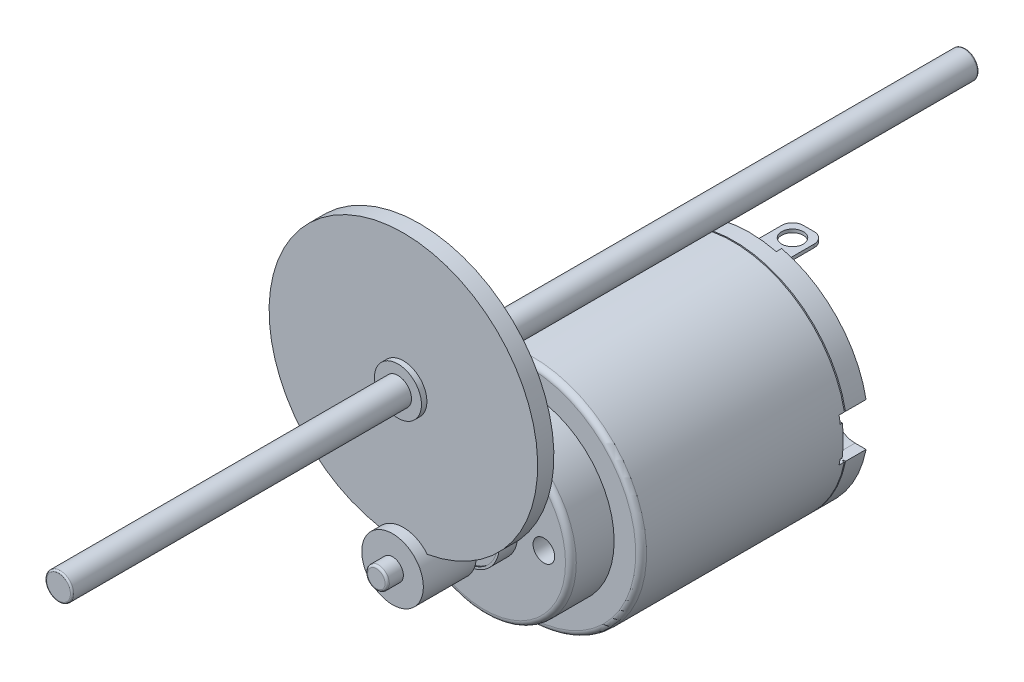
from build123d import *
from build123d.topology import SkipClean

# Parameters (mm, degrees)
ESBO_O1_R                   = 1
RESSALTO_EXTRUS_O1_DEPTH    = 38
ESBO_O2_R                   = 8
RESSALTO_EXTRUS_O2_DEPTH    = 25
ESBO_O3_R                   = 3.075
RESSALTO_EXTRUS_O3_DEPTH    = 1.7
ESBO_O4_R                   = 10.5
RESSALTO_EXTRUS_O4_DEPTH    = 21
ESBO_O5_R                   = 3.125
RESSALTO_EXTRUS_O5_DEPTH    = 2
ESBO_O6_W                   = 3
ESBO_O6_H                   = 0.3
RESSALTO_EXTRUS_O6_DEPTH    = 5
ESBO_O7_R                   = 1
CORTE_EXTRUS_O1_DEPTH       = 4
ESBO_O8_R                   = 1
CORTE_EXTRUS_O2_DEPTH       = 4
FILETE1_R                   = 1
FILETE2_R                   = 0.2
CORTE_EXTRUS_O3_DEPTH       = 15
CORTE_EXTRUS_O3_DEPTH_BACK  = 38
ESBO_O9_R                   = 1
ESBO_O10_W                  = 1.239132447
ESBO_O10_H                  = 9.327126009
CORTE_EXTRUS_O4_DEPTH       = 2
CORTE_EXTRUS_O5_DEPTH       = 0.5
CORTE_EXTRUS_O6_DEPTH       = 2
ESBO_O13_W                  = 3
ESBO_O13_H                  = 0.3
RESSALTO_EXTRUS_O7_DEPTH    = 6
ESBO_O14_R                  = 11.30933102
ESBO_O14_R_2                = 10.3
CORTE_EXTRUS_O7_DEPTH       = 0.1
FILETE3_R                   = 0.5
ESBO_O15_R                  = 2.875
CORTE_EXTRUS_O8_DEPTH       = 0.1
CORTE_EXTRUS_O9_DEPTH       = 2.5
RESSALTO_EXTRUS_O8_DEPTH    = 0.2
ESBO_O18_R                  = 2.85
RESSALTO_EXTRUS_O9_DEPTH    = 4.9
ESBO_O19_R                  = 12.425
RESSALTO_EXTRUS_O10_DEPTH   = 1.5
ESBO_O20_R                  = 2.175
RESSALTO_EXTRUS_O11_DEPTH   = 2
ESBO_O21_R                  = 2.175
RESSALTO_EXTRUS_O12_DEPTH   = 3.9
CORTE_EXTRUS_O10_DEPTH      = 12
CORTE_EXTRUS_O10_DEPTH_BACK = 7.9
ESBO_O22_R                  = 1.25
ESBO_O23_R                  = 1.25
RESSALTO_EXTRUS_O13_DEPTH   = 83.9
FILETE4_R                   = 0.15


with BuildPart() as part:
    # Esboço1 → Ressalto-extrusão1 (new body)
    with BuildSketch(Plane.XY):
        Circle(ESBO_O1_R)
    extrude(amount=RESSALTO_EXTRUS_O1_DEPTH)

    # Esboço2 → Ressalto-extrusão2 (add)
    with BuildSketch(Plane.XY.offset(28)):
        Circle(ESBO_O2_R)
    extrude(amount=-RESSALTO_EXTRUS_O2_DEPTH)

    # Esboço3 → Ressalto-extrusão3 (add)
    with BuildSketch(Plane.XY.offset(28)):
        Circle(ESBO_O3_R)
    extrude(amount=RESSALTO_EXTRUS_O3_DEPTH)

    # Esboço4 → Ressalto-extrusão4 (add)
    with BuildSketch(Plane(origin=(0, 0, 3), x_dir=(-1, 0, 0), z_dir=(0, 0, -1))):
        Circle(ESBO_O4_R)
    extrude(amount=-RESSALTO_EXTRUS_O4_DEPTH)

    # Esboço5 → Ressalto-extrusão5 (add)
    with BuildSketch(Plane(origin=(0, 0, 3), x_dir=(-1, 0, 0), z_dir=(0, 0, -1))):
        Circle(ESBO_O5_R)
    extrude(amount=RESSALTO_EXTRUS_O5_DEPTH)

    # Esboço6 → Ressalto-extrusão6 (add)
    with BuildSketch(Plane(origin=(0, 0, 3), x_dir=(-1, 0, 0), z_dir=(0, 0, -1))):
        with Locations((0, 7.9)):
            Rectangle(ESBO_O6_W, ESBO_O6_H)
        with Locations((0, -7.9)):
            Rectangle(ESBO_O6_W, ESBO_O6_H)
    extrude(amount=RESSALTO_EXTRUS_O6_DEPTH)

    # Esboço7 → Corte-extrusão1 (cut)
    with BuildSketch(Plane(origin=(0, 8.05, 0), x_dir=(1, 0, 0), z_dir=(0, 1, 0))):
        with Locations((0, 0.5)):
            Circle(ESBO_O7_R)
    extrude(amount=-CORTE_EXTRUS_O1_DEPTH, mode=Mode.SUBTRACT)

    # Esboço8 → Corte-extrusão2 (cut)
    with BuildSketch(Plane(origin=(0, -7.75, 0), x_dir=(1, 0, 0), z_dir=(0, 1, 0))):
        with Locations((0, 0.5)):
            Circle(ESBO_O8_R)
    extrude(amount=-CORTE_EXTRUS_O2_DEPTH, mode=Mode.SUBTRACT)

    # Filete1
    filete1_edges = [part.edges().sort_by_distance(p)[0] for p in [
        (1.5, -7.9, -2),
        (-1.5, -7.9, -2),
        (1.5, 7.9, -2),
        (-1.5, 7.9, -2),
    ]]
    fillet(filete1_edges, radius=FILETE1_R)

    # Filete2
    filete2_edges = [part.edges().sort_by_distance(p)[0] for p in [
        (-1, 0, 0),
        (-1, 0, 38),
    ]]
    fillet(filete2_edges, radius=FILETE2_R)

    # Esboço9 → Corte-extrusão3 (cut, two sides: drawn at the far end of the back side and taken through both)
    with BuildSketch(Plane(origin=(0, 0, 3), x_dir=(-1, 0, 0), z_dir=(0, 0, -1)).offset(-CORTE_EXTRUS_O3_DEPTH_BACK)):
        with Locations((-5.5, 0)):
            Circle(ESBO_O9_R)
        with Locations((5.5, 0)):
            Circle(ESBO_O9_R)
    extrude(amount=CORTE_EXTRUS_O3_DEPTH + CORTE_EXTRUS_O3_DEPTH_BACK, mode=Mode.SUBTRACT)

    # Esboço10 → Corte-extrusão4 (cut)
    with BuildSketch(Plane(origin=(0, 0, 1), x_dir=(-1, 0, 0), z_dir=(0, 0, -1))):
        with Locations((3.194566224, -0.245450684)):
            Rectangle(ESBO_O10_W, ESBO_O10_H)
    extrude(amount=-CORTE_EXTRUS_O4_DEPTH, mode=Mode.SUBTRACT)

    # Esboço11 → Corte-extrusão5 (cut)
    with BuildSketch(Plane(origin=(0, 0, 3), x_dir=(-1, 0, 0), z_dir=(0, 0, -1))):
        with BuildLine():
            Line((-3.708099244, 1.5), (-7.348469228, 1.5))
            ThreePointArc((-7.348469228, 1.5), (-5.657498182, 4.923689097), (-2.5, 7.071067812))
            Line((-2.5, 7.071067812), (-2.5, 12.5))
            Line((-2.5, 12.5), (2.5, 12.5))
            Line((2.5, 12.5), (2.5, 7.071067812))
            ThreePointArc((2.5, 7.071067812), (5.657498182, 4.923689097), (7.348469228, 1.5))
            Line((7.348469228, 1.5), (3.708099244, 1.5))
            ThreePointArc((3.708099244, 1.5), (3.208309493, 2.388880532), (2.5, 3.122498999))
            ThreePointArc((2.5, 3.122498999), (-1.011435463, 3.870012701), (-3.708099244, 1.5))
        make_face()
        with BuildLine():
            Line((7.348469228, -1.5), (3.708099244, -1.5))
            ThreePointArc((3.708099244, -1.5), (1.011435463, -3.870012701), (-2.5, -3.122498999))
            ThreePointArc((-2.5, -3.122498999), (-3.208309493, -2.388880532), (-3.708099244, -1.5))
            Line((-3.708099244, -1.5), (-7.348469228, -1.5))
            ThreePointArc((-7.348469228, -1.5), (-5.657498182, -4.923689097), (-2.5, -7.071067812))
            Line((-2.5, -7.071067812), (-2.5, -12.5))
            Line((-2.5, -12.5), (2.5, -12.5))
            Line((2.5, -12.5), (2.5, -7.071067812))
            ThreePointArc((2.5, -7.071067812), (5.657498182, -4.923689097), (7.348469228, -1.5))
        make_face()
    extrude(amount=-CORTE_EXTRUS_O5_DEPTH, mode=Mode.SUBTRACT)


with BuildPart() as corte_extrus_o5_piece_1:
    # of the separate pieces the step leaves, piece 1, a body of its own (corte_extrus_o5_pieces)
    add(part.part.solids().sort_by_distance((1, 0, 0.2))[0])

    # Esboço12 → Corte-extrusão6 (cut)
    with BuildSketch(Plane(origin=(0, 0, 3.5), x_dir=(-1, 0, 0), z_dir=(0, 0, -1))):
        with BuildLine():
            ThreePointArc((3.375, -5.845671476), (4.772970773, -4.772970773), (5.845671476, -3.375))
            ThreePointArc((5.845671476, -3.375), (5.479646072, -2.008974596), (4.113620668, -2.375))
            ThreePointArc((4.113620668, -2.375), (3.358757211, -3.358757211), (2.375, -4.113620668))
            ThreePointArc((2.375, -4.113620668), (2.008974596, -5.479646072), (3.375, -5.845671476))
        make_face()
        with BuildLine():
            ThreePointArc((-3.375, 5.845671476), (-4.772970773, 4.772970773), (-5.845671476, 3.375))
            ThreePointArc((-5.845671476, 3.375), (-5.479646072, 2.008974596), (-4.113620668, 2.375))
            ThreePointArc((-4.113620668, 2.375), (-3.358757211, 3.358757211), (-2.375, 4.113620668))
            ThreePointArc((-2.375, 4.113620668), (-2.008974596, 5.479646072), (-3.375, 5.845671476))
        make_face()
    extrude(amount=-CORTE_EXTRUS_O6_DEPTH, mode=Mode.SUBTRACT)



with BuildPart() as corte_extrus_o5_piece_2:
    # of the separate pieces the step leaves, piece 2, a body of its own (corte_extrus_o5_pieces)
    add(part.part.solids().sort_by_distance((1.5, 8.05, -1))[0])


with BuildPart() as corte_extrus_o5_piece_3:
    # of the separate pieces the step leaves, piece 3, a body of its own (corte_extrus_o5_pieces)
    add(part.part.solids().sort_by_distance((-1.5, -8.05, -1))[0])


with BuildPart() as corte_extrus_o5_piece_1_1:
    add(corte_extrus_o5_piece_1.part)

    add(corte_extrus_o5_piece_2.part)  # Ressalto-extrusão7 merges Corte-extrusão5 piece 2

    add(corte_extrus_o5_piece_3.part)  # Ressalto-extrusão7 merges Corte-extrusão5 piece 3
    # Esboço13 → Ressalto-extrusão7 (add)
    with BuildSketch(Plane.XY.offset(3)):
        with Locations((0, 7.9)):
            Rectangle(ESBO_O13_W, ESBO_O13_H)
        with Locations((0, -7.9)):
            Rectangle(ESBO_O13_W, ESBO_O13_H)
    extrude(amount=RESSALTO_EXTRUS_O7_DEPTH)

    # Esboço14 → Corte-extrusão7 (cut)
    with BuildSketch(Plane(origin=(0, 0, 5), x_dir=(-1, 0, 0), z_dir=(0, 0, -1))):
        Circle(ESBO_O14_R)
        Circle(ESBO_O14_R_2, mode=Mode.SUBTRACT)
    extrude(amount=CORTE_EXTRUS_O7_DEPTH, mode=Mode.SUBTRACT)

    # Filete3
    filete3_edges = [corte_extrus_o5_piece_1_1.edges().sort_by_distance(p)[0] for p in [
        (-8, 0, 28),
        (10.5, 0, 24),
    ]]
    fillet(filete3_edges, radius=FILETE3_R)

    # Esboço15 → Corte-extrusão8 (cut)
    with BuildSketch(Plane.XY.offset(29.7)):
        Circle(ESBO_O15_R)
    extrude(amount=-CORTE_EXTRUS_O8_DEPTH, mode=Mode.SUBTRACT)


with BuildPart() as corte_extrus_o8_piece_1:
    # of the separate pieces the step leaves, piece 1, a body of its own (corte_extrus_o8_pieces)
    add(corte_extrus_o5_piece_1_1.part.solids().sort_by_distance((7.5, 0, 28))[0])

    # Esboço16 → Corte-extrusão9 (cut)
    with BuildSketch(Plane(origin=(0, 0, 3), x_dir=(-1, 0, 0), z_dir=(0, 0, -1))):
        with BuildLine():
            Line((-9.287087811, 2), (-10.307764064, 2))
            ThreePointArc((-10.307764064, 2), (-10.5, 0), (-10.307764064, -2))
            Line((-10.307764064, -2), (-9.287087811, -2))
            ThreePointArc((-9.287087811, -2), (-7.287087811, 0), (-9.287087811, 2))
        make_face()
        with BuildLine():
            Line((10.307764064, 2), (9.287087811, 2))
            ThreePointArc((9.287087811, 2), (7.287087811, 0), (9.287087811, -2))
            Line((9.287087811, -2), (10.307764064, -2))
            ThreePointArc((10.307764064, -2), (10.5, 0), (10.307764064, 2))
        make_face()
    extrude(amount=-CORTE_EXTRUS_O9_DEPTH, mode=Mode.SUBTRACT)

    # Esboço17 → Ressalto-extrusão8 (add)
    with SkipClean():  # the faces are left unmerged after this step: merging them gives an invalid solid
        with BuildSketch(Plane(origin=(0, 0, 5.5), x_dir=(-1, 0, 0), z_dir=(0, 0, -1))):
            with BuildLine():
                Line((-8.395134617, 1.117244286), (-8.597314976, 1.317232401))
                Line((-8.597314976, 1.317232401), (-10.417048469, 1.317232401))
                ThreePointArc((-10.417048469, 1.317232401), (-10.499595037, -0.092217463), (-10.392304845, -1.5))
                Line((-10.392304845, -1.5), (-8.566600265, -1.5))
                Line((-8.566600265, -1.5), (-8.368780624, -1.300011885))
                Line((-8.368780624, -1.300011885), (-8.395134617, 1.117244286))
            make_face()
            with BuildLine():
                ThreePointArc((10.392304845, -1.5), (10.499595037, -0.092217463), (10.417048469, 1.317232401))
                Line((10.417048469, 1.317232401), (8.597314976, 1.317232401))
                Line((8.597314976, 1.317232401), (8.395134617, 1.117244286))
                Line((8.395134617, 1.117244286), (8.368780624, -1.300011885))
                Line((8.368780624, -1.300011885), (8.566600265, -1.5))
                Line((8.566600265, -1.5), (10.392304845, -1.5))
            make_face()
        extrude(amount=RESSALTO_EXTRUS_O8_DEPTH)


with BuildPart() as corte_extrus_o8_piece_2:
    # of the separate pieces the step leaves, piece 2, a body of its own (corte_extrus_o8_pieces)
    add(corte_extrus_o5_piece_1_1.part.solids().sort_by_distance((1, 0, 37.8))[0])

    # Esboço18 → Ressalto-extrusão9 (add)
    with BuildSketch(Plane.XY.offset(36.5)):
        Circle(ESBO_O18_R)
    extrude(amount=-RESSALTO_EXTRUS_O9_DEPTH)

    # Esboço19 → Ressalto-extrusão10 (add)
    with BuildSketch(Plane.XY.offset(35.5)):
        with Locations((0, 14.025)):
            Circle(ESBO_O19_R)
    extrude(amount=-RESSALTO_EXTRUS_O10_DEPTH)

    # Esboço20 → Ressalto-extrusão11 (add)
    with BuildSketch(Plane(origin=(0, 0, 34), x_dir=(-1, 0, 0), z_dir=(0, 0, -1))):
        with Locations((0, 14.025)):
            Circle(ESBO_O20_R)
    extrude(amount=-RESSALTO_EXTRUS_O11_DEPTH)

    # Esboço21 → Ressalto-extrusão12 (add)
    with BuildSketch(Plane.XY.offset(36)):
        with Locations((0, 14.025)):
            Circle(ESBO_O21_R)
    extrude(amount=-RESSALTO_EXTRUS_O12_DEPTH)

    # Esboço22 → Corte-extrusão10 (cut, two sides: drawn at the far end of the back side and taken through both)
    with BuildSketch(Plane(origin=(0, 0, 32.1), x_dir=(-1, 0, 0), z_dir=(0, 0, -1)).offset(-CORTE_EXTRUS_O10_DEPTH_BACK)):
        with Locations((0, 14.025)):
            Circle(ESBO_O22_R)
    extrude(amount=CORTE_EXTRUS_O10_DEPTH + CORTE_EXTRUS_O10_DEPTH_BACK, mode=Mode.SUBTRACT)

    # Esboço23 → Ressalto-extrusão13 (add)
    with BuildSketch(Plane.XY.offset(-16.5)):
        with Locations((0, 14.025)):
            Circle(ESBO_O23_R)
    extrude(amount=RESSALTO_EXTRUS_O13_DEPTH)

    # Filete4
    filete4_edges = [corte_extrus_o8_piece_2.edges().sort_by_distance(p)[0] for p in [
        (-1.25, 14.025, -16.5),
        (-1.25, 14.025, 67.4),
    ]]
    fillet(filete4_edges, radius=FILETE4_R)


solid = Compound([corte_extrus_o8_piece_1.part, corte_extrus_o8_piece_2.part])
